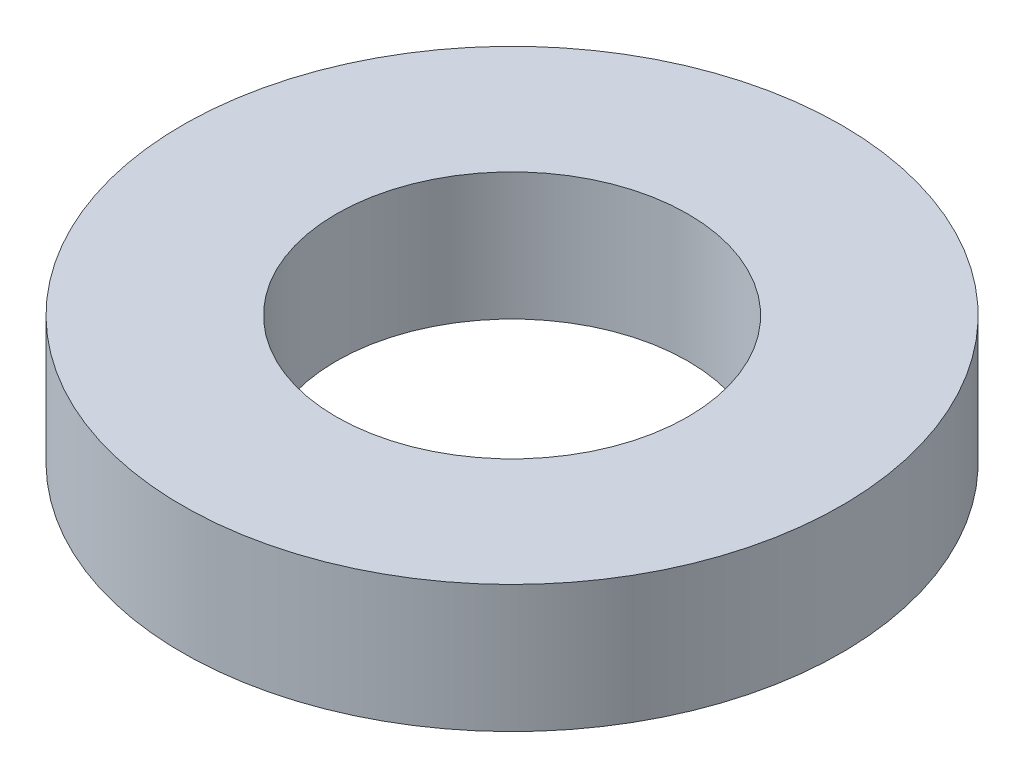
from build123d import *

# Parameters (mm, degrees)
SKETCH1_R           = 75
BOSS_EXTRUDE1_DEPTH = 29
SKETCH2_R           = 40
CUT_EXTRUDE1_DEPTH  = 110.959083299


with BuildPart() as part:
    # Sketch1 → Boss-Extrude1 (new body)
    with BuildSketch(Plane(origin=(0, 0, 0), x_dir=(1, 0, 0), z_dir=(0, 1, 0))):
        Circle(SKETCH1_R)
    extrude(amount=BOSS_EXTRUDE1_DEPTH)

    # Sketch2 → Cut-Extrude1 (cut, through all)
    with BuildSketch(Plane(origin=(0, 0, 0), x_dir=(1, 0, 0), z_dir=(0, 1, 0))):
        Circle(SKETCH2_R)
    extrude(amount=CUT_EXTRUDE1_DEPTH, mode=Mode.SUBTRACT)


solid = part.part
